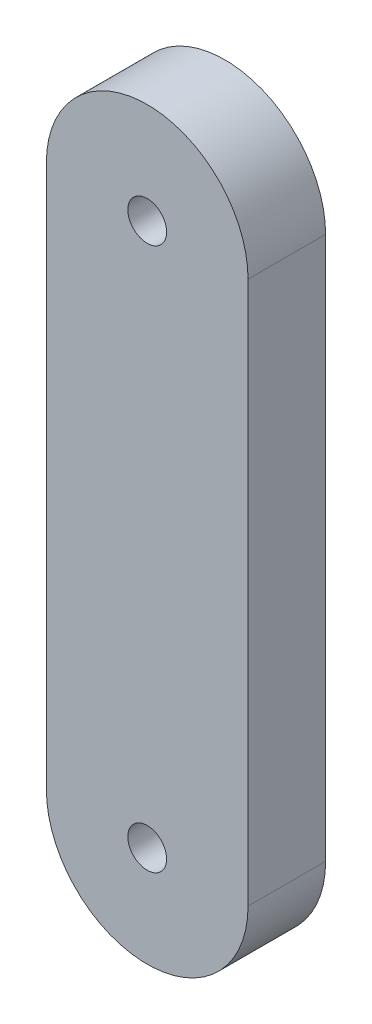
from build123d import *

# Parameters (mm, degrees)
SKETCH1_R           = 0.625
BOSS_EXTRUDE1_DEPTH = 2.5


with BuildPart() as part:
    # Sketch1 → Boss-Extrude1 (new body)
    with BuildSketch(Plane.XY):
        with BuildLine():
            Line((-3.25, 0), (-3.25, 17.5))
            ThreePointArc((-3.25, 17.5), (0, 20.75), (3.25, 17.5))
            Line((3.25, 17.5), (3.25, 0))
            ThreePointArc((3.25, 0), (0, -3.25), (-3.25, 0))
        make_face()
        with Locations((0, 17.5)):
            Circle(SKETCH1_R, mode=Mode.SUBTRACT)
        Circle(SKETCH1_R, mode=Mode.SUBTRACT)
    extrude(amount=BOSS_EXTRUDE1_DEPTH)


solid = part.part
